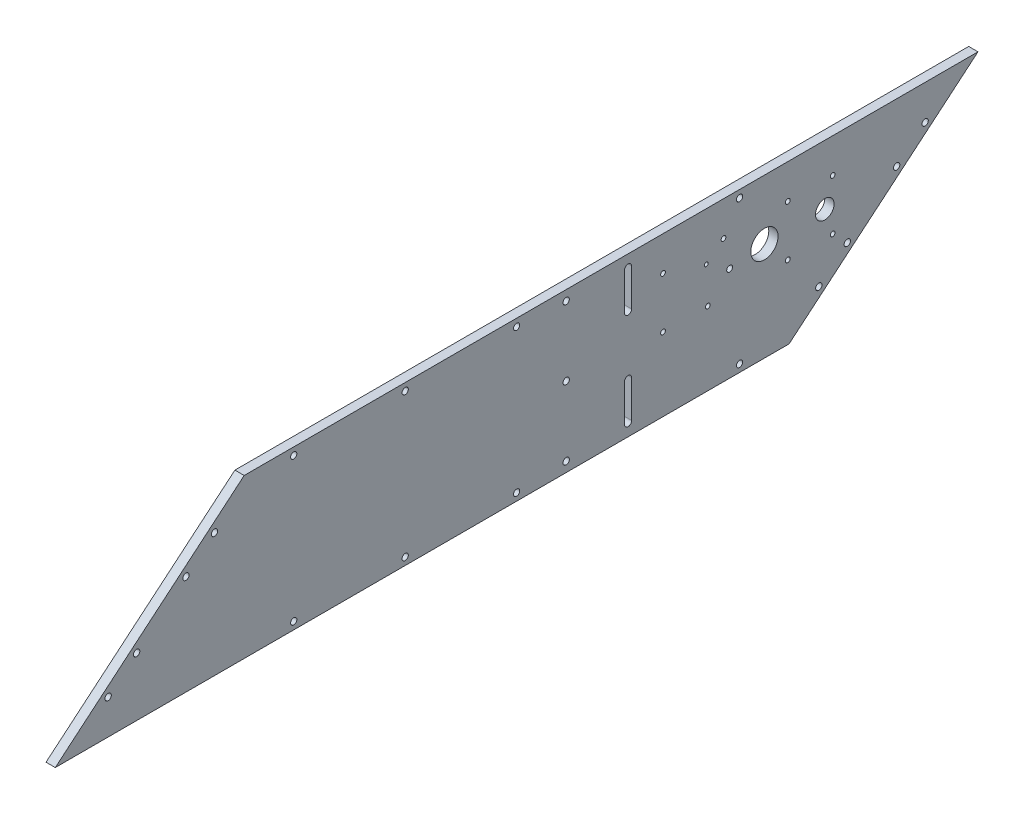
from build123d import *

# Parameters (mm, degrees)
BOSS_EXTRUDE1_DEPTH           = 4.7625
SKETCH2_R                     = 6.9977
SKETCH2_R_2                   = 1.4986
SKETCH2_R_3                   = 0.9906
SKETCH2_R_4                   = 4.7625
GEARBOX_WITH_PRESS_FITS_DEPTH = 412.602247496
SKETCH6_R                     = 1.59385
CUT_EXTRUDE2_DEPTH            = 412.602247496
F_4_CLEARANCE_HOLE2_D         = 3.2639
F_2_CLEARANCE_HOLE1_D         = 2.4384
F_2_CLEARANCE_HOLE1_DEPTH     = 4.826
F_2_CLEARANCE_HOLE1_TIP       = 0.732569267
F_4_CLEARANCE_HOLE1_D         = 3.2639
F_4_CLEARANCE_HOLE1_DEPTH     = 4.826
F_4_CLEARANCE_HOLE1_TIP       = 0.980574487


with BuildPart() as part:
    # Sketch1 → Boss-Extrude1 (new body)
    with BuildSketch(Plane(origin=(0, 0, 0), x_dir=(0, 0, -1), z_dir=(1, 0, 0))):
        Polygon((33.297595377, -40.64), (312.697595377, -40.64), (345.995190754, -12.7), (409.563327383, 40.64), (312.697595377, 40.64), (33.297595377, 40.64), (0, 12.7), (-63.568136629, -40.64), align=None)
    extrude(amount=BOSS_EXTRUDE1_DEPTH)

    # Sketch2 → Gearbox (with Press fits) (cut, through all)
    with BuildSketch(Plane(origin=(4.7625, 0, 0), x_dir=(0, 0, -1), z_dir=(1, 0, 0))):
        with Locations((300.047997426, 10)):
            Circle(SKETCH2_R)
        with Locations((282.214696722, 8)):
            Circle(SKETCH2_R_2)
        with Locations((270.217776392, 15.933400182)):
            Circle(SKETCH2_R_3)
        with Locations((331.004197426, 10)):
            Circle(SKETCH2_R_4)
    extrude(amount=-GEARBOX_WITH_PRESS_FITS_DEPTH, mode=Mode.SUBTRACT)

    # Sketch6 → Cut-Extrude2 (cut, through all)
    with BuildSketch(Plane(origin=(4.7625, 0, 0), x_dir=(0, 0, -1), z_dir=(1, 0, 0))):
        with Locations((287.297595377, 36.83)):
            Circle(SKETCH6_R)
        with Locations((172.997595377, 36.83)):
            Circle(SKETCH6_R)
        with Locations((115.847595377, 36.83)):
            Circle(SKETCH6_R)
        with Locations((58.697595377, 36.83)):
            Circle(SKETCH6_R)
        with Locations((58.697595377, -36.83)):
            Circle(SKETCH6_R)
        with Locations((115.847595377, -36.83)):
            Circle(SKETCH6_R)
        with Locations((172.997595377, -36.83)):
            Circle(SKETCH6_R)
        with Locations((287.297595377, -36.83)):
            Circle(SKETCH6_R)
        with BuildLine():
            Line((231.976395377, 34.29), (231.976395377, 15.24))
            ThreePointArc((231.976395377, 15.24), (230.147595377, 13.4112), (228.318795377, 15.24))
            Line((228.318795377, 15.24), (228.318795377, 34.29))
            ThreePointArc((228.318795377, 34.29), (230.147595377, 36.1188), (231.976395377, 34.29))
        make_face()
        with BuildLine():
            Line((231.976395377, -34.29), (231.976395377, -15.24))
            ThreePointArc((231.976395377, -15.24), (230.147595377, -13.4112), (228.318795377, -15.24))
            Line((228.318795377, -15.24), (228.318795377, -34.29))
            ThreePointArc((228.318795377, -34.29), (230.147595377, -36.1188), (231.976395377, -34.29))
        make_face()
    extrude(amount=-CUT_EXTRUDE2_DEPTH, mode=Mode.SUBTRACT)

    # #4 Clearance Hole2 (through all)
    with Locations(Plane(origin=(4.7625, 0, 0), x_dir=(0, 0, -1), z_dir=(1, 0, 0))):
        with Locations((198.397595377, 35.56), (198.397595377, -35.56), (198.397595377, 0)):
            Hole(F_4_CLEARANCE_HOLE2_D / 2)

    # #2 Clearance Hole1
    with Locations(Plane(origin=(4.7625, 0, 0), x_dir=(0, 0, -1), z_dir=(1, 0, 0))):
        with Locations((248.047997486, -3), (248.047997486, 23), (271.047997556, -3), (312.047997486, -3), (279.047997486, 23), (312.047997486, 23), (335.047997486, 23), (335.047997486, -3)):
            Hole(F_2_CLEARANCE_HOLE1_D / 2, depth=F_2_CLEARANCE_HOLE1_DEPTH)
            with Locations((0, 0, -(F_2_CLEARANCE_HOLE1_DEPTH + F_2_CLEARANCE_HOLE1_TIP / 2))):  # 118° drill point
                Cone(0, F_2_CLEARANCE_HOLE1_D / 2, F_2_CLEARANCE_HOLE1_TIP, mode=Mode.SUBTRACT)

    # #4 Clearance Hole1
    with Locations(Plane(origin=(4.7625, 0, 0), x_dir=(0, 0, -1), z_dir=(1, 0, 0))):
        with Locations((327.962613202, -22.8575274), (342.555759844, -10.612423436), (367.850547356, 10.612423436), (382.443693997, 22.8575274), (-36.448503243, -22.8575274), (-21.855356602, -10.612423436), (3.43943091, 10.612423436), (18.032577552, 22.8575274)):
            Hole(F_4_CLEARANCE_HOLE1_D / 2, depth=F_4_CLEARANCE_HOLE1_DEPTH)
            with Locations((0, 0, -(F_4_CLEARANCE_HOLE1_DEPTH + F_4_CLEARANCE_HOLE1_TIP / 2))):  # 118° drill point
                Cone(0, F_4_CLEARANCE_HOLE1_D / 2, F_4_CLEARANCE_HOLE1_TIP, mode=Mode.SUBTRACT)


solid = part.part
